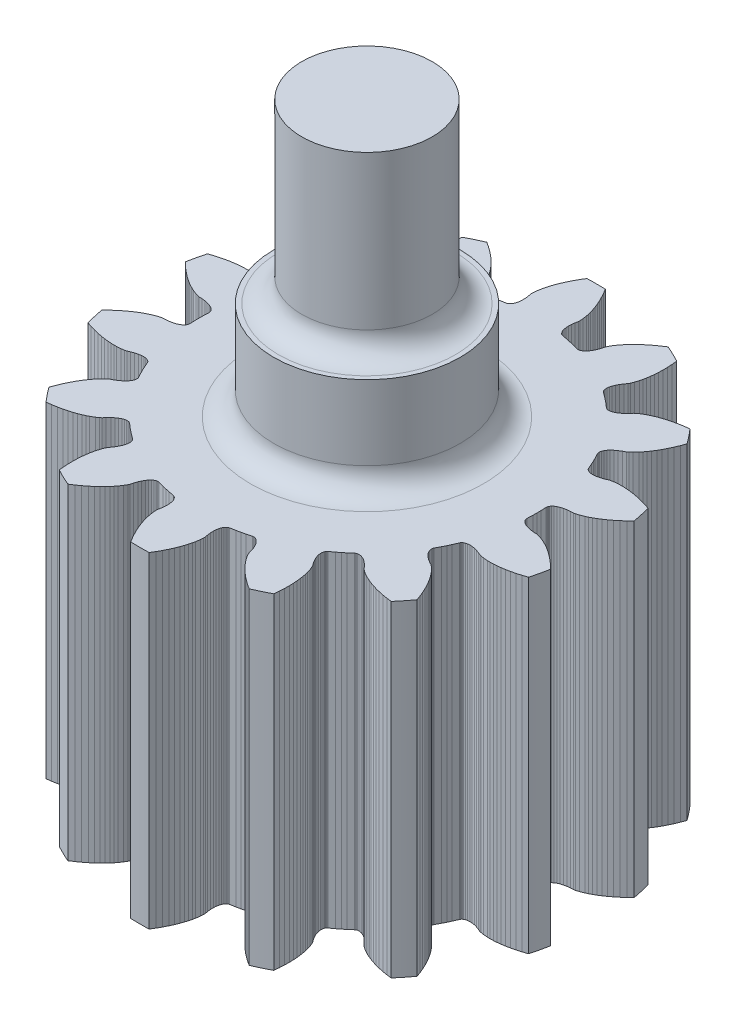
from build123d import *

# Parameters (mm, degrees)
SKETCH1_R           = 2
BOSS_EXTRUDE1_DEPTH = 2.1
SKETCH2_R           = 1.4
BOSS_EXTRUDE3_DEPTH = 3.8
BOSS_EXTRUDE4_DEPTH = 7
FILLET1_R           = 0.5


with BuildPart() as part:
    # Sketch1 → Boss-Extrude1 (new body)
    with BuildSketch(Plane(origin=(0, 0, 0), x_dir=(1, 0, 0), z_dir=(0, 1, 0))):
        Circle(SKETCH1_R)
    extrude(amount=BOSS_EXTRUDE1_DEPTH)

    # Sketch2 → Boss-Extrude3 (add)
    with BuildSketch(Plane(origin=(0, 2.1, 0), x_dir=(1, 0, 0), z_dir=(0, 1, 0))):
        Circle(SKETCH2_R)
    extrude(amount=BOSS_EXTRUDE3_DEPTH)

    # Sketch4 → Boss-Extrude4 (add)
    with BuildSketch(Plane.XZ):
        with BuildLine():
            Line((-3.882190711, -2.730032774), (-3.922357711, -2.826903874))
            Line((-3.922357711, -2.826903874), (-3.959795863, -2.92899104))
            ThreePointArc((-3.959795863, -2.92899104), (-3.839676009, -3.086014144), (-3.713318819, -3.238063133))
            Line((-3.713318819, -3.238063133), (-3.605460319, -3.224280033))
            Line((-3.605460319, -3.224280033), (-3.502080019, -3.206675933))
            Line((-3.502080019, -3.206675933), (-3.402592619, -3.185404633))
            Line((-3.402592619, -3.185404633), (-3.313761919, -3.162452233))
            Line((-3.313761919, -3.162452233), (-3.233593119, -3.138155933))
            Line((-3.233593119, -3.138155933), (-3.159130419, -3.112161433))
            Line((-3.159130419, -3.112161433), (-3.092797119, -3.085823533))
            Line((-3.092797119, -3.085823533), (-3.034401719, -3.059767933))
            Line((-3.034401719, -3.059767933), (-2.982345219, -3.033850233))
            Line((-2.982345219, -3.033850233), (-2.902885819, -2.988037433))
            Line((-2.902885819, -2.988037433), (-2.849189719, -2.950841433))
            Line((-2.849189719, -2.950841433), (-2.819950519, -2.926718933))
            Line((-2.819950519, -2.926718933), (-2.780656419, -2.880621433))
            Line((-2.780656419, -2.880621433), (-2.731486019, -2.830415233))
            Line((-2.731486019, -2.830415233), (-2.683265219, -2.789210933))
            Line((-2.683265219, -2.789210933), (-2.636656719, -2.756812533))
            Line((-2.636656719, -2.756812533), (-2.592302519, -2.733015133))
            Line((-2.592302519, -2.733015133), (-2.550843419, -2.717563333))
            Line((-2.550843419, -2.717563333), (-2.512882719, -2.710155233))
            Line((-2.512882719, -2.710155233), (-2.479026819, -2.710460633))
            Line((-2.479026819, -2.710460633), (-2.463811019, -2.713385733))
            Line((-2.463811019, -2.713385733), (-2.449837119, -2.718108733))
            Line((-2.449837119, -2.718108733), (-2.437161419, -2.724571933))
            Line((-2.437161419, -2.724571933), (-2.425862119, -2.732713033))
            Line((-2.425862119, -2.732713033), (-2.335971819, -2.810486433))
            Line((-2.335971819, -2.810486433), (-2.269113919, -2.865095733))
            Line((-2.269113919, -2.865095733), (-2.200996419, -2.918125733))
            Line((-2.200996419, -2.918125733), (-2.105170519, -2.988456133))
            Line((-2.105170519, -2.988456133), (-2.094719219, -2.997660533))
            Line((-2.094719219, -2.997660533), (-2.085597419, -3.008580133))
            Line((-2.085597419, -3.008580133), (-2.077883319, -3.021152733))
            Line((-2.077883319, -3.021152733), (-2.071645719, -3.035336233))
            Line((-2.071645719, -3.035336233), (-2.063814319, -3.068275333))
            Line((-2.063814319, -3.068275333), (-2.062589619, -3.106932733))
            Line((-2.062589619, -3.106932733), (-2.068428519, -3.150790633))
            Line((-2.068428519, -3.150790633), (-2.081759619, -3.199328233))
            Line((-2.081759619, -3.199328233), (-2.102974319, -3.251977533))
            Line((-2.102974319, -3.251977533), (-2.132415419, -3.308158133))
            Line((-2.132415419, -3.308158133), (-2.170421319, -3.367267633))
            Line((-2.170421319, -3.367267633), (-2.206619419, -3.415834233))
            Line((-2.206619419, -3.415834233), (-2.223630719, -3.449708033))
            Line((-2.223630719, -3.449708033), (-2.247945619, -3.510334833))
            Line((-2.247945619, -3.510334833), (-2.274928419, -3.597996233))
            Line((-2.274928419, -3.597996233), (-2.288612619, -3.654514833))
            Line((-2.288612619, -3.654514833), (-2.301020719, -3.717244133))
            Line((-2.301020719, -3.717244133), (-2.311937819, -3.787775033))
            Line((-2.311937819, -3.787775033), (-2.320711019, -3.866155133))
            Line((-2.320711019, -3.866155133), (-2.326558919, -3.949720333))
            Line((-2.326558919, -3.949720333), (-2.329169219, -4.041431233))
            Line((-2.329169219, -4.041431233), (-2.327769219, -4.143157633))
            Line((-2.327769219, -4.143157633), (-2.321927619, -4.247863233))
            Line((-2.321927619, -4.247863233), (-2.311364337, -4.356084574))
            ThreePointArc((-2.311364337, -4.356084574), (-2.13501511, -4.445436972), (-1.955204614, -4.527601965))
            Line((-1.955204614, -4.527601965), (-1.864007714, -4.468385765))
            Line((-1.864007714, -4.468385765), (-1.778503414, -4.407669965))
            Line((-1.778503414, -4.407669965), (-1.698097614, -4.345339265))
            Line((-1.698097614, -4.345339265), (-1.628022614, -4.286117565))
            Line((-1.628022614, -4.286117565), (-1.566334814, -4.229443465))
            Line((-1.566334814, -4.229443465), (-1.510524814, -4.173715165))
            Line((-1.510524814, -4.173715165), (-1.462188214, -4.121204465))
            Line((-1.462188214, -4.121204465), (-1.420880814, -4.072392365))
            Line((-1.420880814, -4.072392365), (-1.385224814, -4.026454865))
            Line((-1.385224814, -4.026454865), (-1.333511814, -3.950702865))
            Line((-1.333511814, -3.950702865), (-1.301272014, -3.893892465))
            Line((-1.301272014, -3.893892465), (-1.285394814, -3.859472565))
            Line((-1.285394814, -3.859472565), (-1.269993014, -3.800890965))
            Line((-1.269993014, -3.800890965), (-1.247475614, -3.734322565))
            Line((-1.247475614, -3.734322565), (-1.221908114, -3.676276565))
            Line((-1.221908114, -3.676276565), (-1.193972314, -3.626863965))
            Line((-1.193972314, -3.626863965), (-1.164335914, -3.586178665))
            Line((-1.164335914, -3.586178665), (-1.133686914, -3.554268665))
            Line((-1.133686914, -3.554268665), (-1.102699714, -3.531123665))
            Line((-1.102699714, -3.531123665), (-1.072064114, -3.516709265))
            Line((-1.072064114, -3.516709265), (-1.057086014, -3.512742765))
            Line((-1.057086014, -3.512742765), (-1.042446714, -3.510935065))
            Line((-1.042446714, -3.510935065), (-1.028222014, -3.511258465))
            Line((-1.028222014, -3.511258465), (-1.014509414, -3.513690765))
            Line((-1.014509414, -3.513690765), (-0.899776414, -3.544760165))
            Line((-0.899776414, -3.544760165), (-0.815845414, -3.564952865))
            Line((-0.815845414, -3.564952865), (-0.731464914, -3.583176265))
            Line((-0.731464914, -3.583176265), (-0.614613514, -3.604964365))
            Line((-0.614613514, -3.604964365), (-0.601203514, -3.608722565))
            Line((-0.601203514, -3.608722565), (-0.588247214, -3.614603065))
            Line((-0.588247214, -3.614603065), (-0.575842014, -3.622583565))
            Line((-0.575842014, -3.622583565), (-0.564068214, -3.632656065))
            Line((-0.564068214, -3.632656065), (-0.542720614, -3.658935165))
            Line((-0.542720614, -3.658935165), (-0.524844414, -3.693232965))
            Line((-0.524844414, -3.693232965), (-0.511075814, -3.735280965))
            Line((-0.511075814, -3.735280965), (-0.502027014, -3.784795965))
            Line((-0.502027014, -3.784795965), (-0.498297114, -3.841436065))
            Line((-0.498297114, -3.841436065), (-0.500446814, -3.904827065))
            Line((-0.500446814, -3.904827065), (-0.509042314, -3.974573065))
            Line((-0.509042314, -3.974573065), (-0.520583314, -4.034035765))
            Line((-0.520583314, -4.034035765), (-0.521212714, -4.071935965))
            Line((-0.521212714, -4.071935965), (-0.516814714, -4.137108665))
            Line((-0.516814714, -4.137108665), (-0.503090514, -4.227796265))
            Line((-0.503090514, -4.227796265), (-0.490897114, -4.284655165))
            Line((-0.490897114, -4.284655165), (-0.474859214, -4.346555865))
            Line((-0.474859214, -4.346555865), (-0.454092914, -4.414838765))
            Line((-0.454092914, -4.414838765), (-0.427989514, -4.489263365))
            Line((-0.427989514, -4.489263365), (-0.397000614, -4.567090265))
            Line((-0.397000614, -4.567090265), (-0.359560614, -4.650851565))
            Line((-0.359560614, -4.650851565), (-0.314161714, -4.741896465))
            Line((-0.314161714, -4.741896465), (-0.263468614, -4.833698365))
            Line((-0.263468614, -4.833698365), (-0.206984165, -4.926626267))
            ThreePointArc((-0.206984165, -4.926626267), (-0.009328709, -4.930614744), (0.188326735, -4.926625674))
            Line((0.188326735, -4.926625674), (0.244799335, -4.833704874))
            Line((0.244799335, -4.833704874), (0.295492535, -4.741902974))
            Line((0.295492535, -4.741902974), (0.340891335, -4.650858074))
            Line((0.340891335, -4.650858074), (0.378331435, -4.567096774))
            Line((0.378331435, -4.567096774), (0.409320235, -4.489269874))
            Line((0.409320235, -4.489269874), (0.435423735, -4.414845274))
            Line((0.435423735, -4.414845274), (0.456189935, -4.346562374))
            Line((0.456189935, -4.346562374), (0.472227835, -4.284661674))
            Line((0.472227835, -4.284661674), (0.484421335, -4.227802774))
            Line((0.484421335, -4.227802774), (0.498145535, -4.137115174))
            Line((0.498145535, -4.137115174), (0.502543435, -4.071942474))
            Line((0.502543435, -4.071942474), (0.501914135, -4.034042274))
            Line((0.501914135, -4.034042274), (0.490373035, -3.974579574))
            Line((0.490373035, -3.974579574), (0.481777635, -3.904833574))
            Line((0.481777635, -3.904833574), (0.479627835, -3.841442574))
            Line((0.479627835, -3.841442574), (0.483357835, -3.784802474))
            Line((0.483357835, -3.784802474), (0.492406535, -3.735287474))
            Line((0.492406535, -3.735287474), (0.506175235, -3.693239474))
            Line((0.506175235, -3.693239474), (0.524051435, -3.658941674))
            Line((0.524051435, -3.658941674), (0.545398935, -3.632662574))
            Line((0.545398935, -3.632662574), (0.557172835, -3.622590074))
            Line((0.557172835, -3.622590074), (0.569578035, -3.614609574))
            Line((0.569578035, -3.614609574), (0.582534335, -3.608729074))
            Line((0.582534335, -3.608729074), (0.595944235, -3.604970874))
            Line((0.595944235, -3.604970874), (0.712795635, -3.583182774))
            Line((0.712795635, -3.583182774), (0.797176235, -3.564959374))
            Line((0.797176235, -3.564959374), (0.881107235, -3.544766674))
            Line((0.881107235, -3.544766674), (0.995840235, -3.513697274))
            Line((0.995840235, -3.513697274), (1.009552735, -3.511264974))
            Line((1.009552735, -3.511264974), (1.023777435, -3.510941574))
            Line((1.023777435, -3.510941574), (1.038416735, -3.512749274))
            Line((1.038416735, -3.512749274), (1.053394935, -3.516715774))
            Line((1.053394935, -3.516715774), (1.084030535, -3.531130174))
            Line((1.084030535, -3.531130174), (1.115017635, -3.554275174))
            Line((1.115017635, -3.554275174), (1.145666735, -3.586185174))
            Line((1.145666735, -3.586185174), (1.175303135, -3.626870474))
            Line((1.175303135, -3.626870474), (1.203238835, -3.676283074))
            Line((1.203238835, -3.676283074), (1.228806335, -3.734329074))
            Line((1.228806335, -3.734329074), (1.251323835, -3.800897474))
            Line((1.251323835, -3.800897474), (1.266725535, -3.859479074))
            Line((1.266725535, -3.859479074), (1.282602835, -3.893898974))
            Line((1.282602835, -3.893898974), (1.314842635, -3.950709374))
            Line((1.314842635, -3.950709374), (1.366555535, -4.026461374))
            Line((1.366555535, -4.026461374), (1.402211635, -4.072398874))
            Line((1.402211635, -4.072398874), (1.443518935, -4.121210974))
            Line((1.443518935, -4.121210974), (1.491855635, -4.173721674))
            Line((1.491855635, -4.173721674), (1.547665635, -4.229449974))
            Line((1.547665635, -4.229449974), (1.609353435, -4.286124074))
            Line((1.609353435, -4.286124074), (1.679428435, -4.345345774))
            Line((1.679428435, -4.345345774), (1.759834235, -4.407676474))
            Line((1.759834235, -4.407676474), (1.845338535, -4.468392274))
            Line((1.845338535, -4.468392274), (1.936535456, -4.527608514))
            ThreePointArc((1.936535456, -4.527608514), (2.116347462, -4.445442796), (2.292698143, -4.356089563))
            Line((2.292698143, -4.356089563), (2.303261443, -4.247868263))
            Line((2.303261443, -4.247868263), (2.309102943, -4.143162663))
            Line((2.309102943, -4.143162663), (2.310503043, -4.041436263))
            Line((2.310503043, -4.041436263), (2.307892743, -3.949725363))
            Line((2.307892743, -3.949725363), (2.302044843, -3.866160163))
            Line((2.302044843, -3.866160163), (2.293271643, -3.787780063))
            Line((2.293271643, -3.787780063), (2.282354543, -3.717249163))
            Line((2.282354543, -3.717249163), (2.269946443, -3.654519863))
            Line((2.269946443, -3.654519863), (2.256262243, -3.598001263))
            Line((2.256262243, -3.598001263), (2.229279343, -3.510339863))
            Line((2.229279343, -3.510339863), (2.204964443, -3.449713063))
            Line((2.204964443, -3.449713063), (2.187953143, -3.415839263))
            Line((2.187953143, -3.415839263), (2.151755143, -3.367272663))
            Line((2.151755143, -3.367272663), (2.113749243, -3.308163163))
            Line((2.113749243, -3.308163163), (2.084308043, -3.251982563))
            Line((2.084308043, -3.251982563), (2.063093443, -3.199333263))
            Line((2.063093443, -3.199333263), (2.049762343, -3.150795663))
            Line((2.049762343, -3.150795663), (2.043923443, -3.106937763))
            Line((2.043923443, -3.106937763), (2.045148143, -3.068280363))
            Line((2.045148143, -3.068280363), (2.052979543, -3.035341263))
            Line((2.052979543, -3.035341263), (2.059217143, -3.021157763))
            Line((2.059217143, -3.021157763), (2.066931243, -3.008585163))
            Line((2.066931243, -3.008585163), (2.076053043, -2.997665563))
            Line((2.076053043, -2.997665563), (2.086504343, -2.988461163))
            Line((2.086504343, -2.988461163), (2.182330243, -2.918130763))
            Line((2.182330243, -2.918130763), (2.250447643, -2.865100763))
            Line((2.250447643, -2.865100763), (2.317305643, -2.810491463))
            Line((2.317305643, -2.810491463), (2.407195943, -2.732718063))
            Line((2.407195943, -2.732718063), (2.418495143, -2.724576963))
            Line((2.418495143, -2.724576963), (2.431170843, -2.718113763))
            Line((2.431170843, -2.718113763), (2.445144743, -2.713390763))
            Line((2.445144743, -2.713390763), (2.460360643, -2.710465663))
            Line((2.460360643, -2.710465663), (2.494216543, -2.710160263))
            Line((2.494216543, -2.710160263), (2.532177243, -2.717568363))
            Line((2.532177243, -2.717568363), (2.573636343, -2.733020163))
            Line((2.573636343, -2.733020163), (2.617990443, -2.756817563))
            Line((2.617990443, -2.756817563), (2.664599043, -2.789215963))
            Line((2.664599043, -2.789215963), (2.712819743, -2.830420263))
            Line((2.712819743, -2.830420263), (2.761990243, -2.880626463))
            Line((2.761990243, -2.880626463), (2.801284343, -2.926723963))
            Line((2.801284343, -2.926723963), (2.830523443, -2.950846463))
            Line((2.830523443, -2.950846463), (2.884219643, -2.988042463))
            Line((2.884219643, -2.988042463), (2.963678943, -3.033855263))
            Line((2.963678943, -3.033855263), (3.015735543, -3.059772963))
            Line((3.015735543, -3.059772963), (3.074130943, -3.085828563))
            Line((3.074130943, -3.085828563), (3.140464243, -3.112166463))
            Line((3.140464243, -3.112166463), (3.214926943, -3.138160963))
            Line((3.214926943, -3.138160963), (3.295095643, -3.162457263))
            Line((3.295095643, -3.162457263), (3.383926343, -3.185409663))
            Line((3.383926343, -3.185409663), (3.483413843, -3.206680963))
            Line((3.483413843, -3.206680963), (3.586794143, -3.224285063))
            Line((3.586794143, -3.224285063), (3.694661261, -3.238058062))
            ThreePointArc((3.694661261, -3.238058062), (3.821015753, -3.086011601), (3.941133142, -2.92899123))
            Line((3.941133142, -2.92899123), (3.903694842, -2.82690403))
            Line((3.903694842, -2.82690403), (3.863527842, -2.73003293))
            Line((3.863527842, -2.73003293), (3.820651842, -2.63777313))
            Line((3.820651842, -2.63777313), (3.778508142, -2.55627703))
            Line((3.778508142, -2.55627703), (3.736981742, -2.48352463))
            Line((3.736981742, -2.48352463), (3.695069542, -2.41671323))
            Line((3.695069542, -2.41671323), (3.654631342, -2.35790383))
            Line((3.654631342, -2.35790383), (3.616234942, -2.30677043))
            Line((3.616234942, -2.30677043), (3.579383342, -2.26178623))
            Line((3.579383342, -2.26178623), (3.517037742, -2.19451343))
            Line((3.517037742, -2.19451343), (3.468825842, -2.15044043))
            Line((3.468825842, -2.15044043), (3.438801842, -2.12730213))
            Line((3.438801842, -2.12730213), (3.385116242, -2.09925093))
            Line((3.385116242, -2.09925093), (3.325227442, -2.06248513))
            Line((3.325227442, -2.06248513), (3.274326042, -2.02464223))
            Line((3.274326042, -2.02464223), (3.232368642, -1.98641153))
            Line((3.232368642, -1.98641153), (3.199298142, -1.94846493))
            Line((3.199298142, -1.94846493), (3.175008242, -1.91148363))
            Line((3.175008242, -1.91148363), (3.159338842, -1.87612313))
            Line((3.159338842, -1.87612313), (3.152102942, -1.84304813))
            Line((3.152102942, -1.84304813), (3.151568842, -1.82756283))
            Line((3.151568842, -1.82756283), (3.153063942, -1.81288833))
            Line((3.153063942, -1.81288833), (3.156544542, -1.79909223))
            Line((3.156544542, -1.79909223), (3.161967142, -1.78626473))
            Line((3.161967142, -1.78626473), (3.217788142, -1.68132193))
            Line((3.217788142, -1.68132193), (3.256150942, -1.60398853))
            Line((3.256150942, -1.60398853), (3.292693842, -1.52577873))
            Line((3.292693842, -1.52577873), (3.339937642, -1.41670533))
            Line((3.339937642, -1.41670533), (3.346585642, -1.40446793))
            Line((3.346585642, -1.40446793), (3.355201742, -1.39314493))
            Line((3.355201742, -1.39314493), (3.365742542, -1.38282663))
            Line((3.365742542, -1.38282663), (3.378182342, -1.37358933))
            Line((3.378182342, -1.37358933), (3.408552942, -1.35862463))
            Line((3.408552942, -1.35862463), (3.445968642, -1.34882853))
            Line((3.445968642, -1.34882853), (3.490026242, -1.34476173))
            Line((3.490026242, -1.34476173), (3.540313342, -1.34695793))
            Line((3.540313342, -1.34695793), (3.596363242, -1.35592513))
            Line((3.596363242, -1.35592513), (3.657686542, -1.37212673))
            Line((3.657686542, -1.37212673), (3.723771242, -1.39602663))
            Line((3.723771242, -1.39602663), (3.779174942, -1.42051003))
            Line((3.779174942, -1.42051003), (3.815984842, -1.42955723))
            Line((3.815984842, -1.42955723), (3.880502142, -1.43977183))
            Line((3.880502142, -1.43977183), (3.971970042, -1.44657163))
            Line((3.971970042, -1.44657163), (4.030116642, -1.44733623))
            Line((4.030116642, -1.44733623), (4.094034142, -1.44547463))
            Line((4.094034142, -1.44547463), (4.165225942, -1.44042333))
            Line((4.165225942, -1.44042333), (4.243593142, -1.43153543))
            Line((4.243593142, -1.43153543), (4.326364442, -1.41864163))
            Line((4.326364442, -1.41864163), (4.416356842, -1.40077893))
            Line((4.416356842, -1.40077893), (4.515221242, -1.37677773))
            Line((4.515221242, -1.37677773), (4.616001842, -1.34778343))
            Line((4.616001842, -1.34778343), (4.719159118, -1.313403525))
            ThreePointArc((4.719159118, -1.313403525), (4.767030365, -1.121591323), (4.807124083, -0.92800395))
            Line((4.807124083, -0.92800395), (4.729099383, -0.85227045))
            Line((4.729099383, -0.85227045), (4.650879383, -0.78242045))
            Line((4.650879383, -0.78242045), (4.572219383, -0.71790045))
            Line((4.572219383, -0.71790045), (4.498889383, -0.66276045))
            Line((4.498889383, -0.66276045), (4.429909383, -0.61523045))
            Line((4.429909383, -0.61523045), (4.363159383, -0.57322045))
            Line((4.363159383, -0.57322045), (4.301209383, -0.53778045))
            Line((4.301209383, -0.53778045), (4.244429383, -0.50837045))
            Line((4.244429383, -0.50837045), (4.191709383, -0.48383045))
            Line((4.191709383, -0.48383045), (4.106349383, -0.45027045))
            Line((4.106349383, -0.45027045), (4.043789383, -0.43148045))
            Line((4.043789383, -0.43148045), (4.006699383, -0.42366045))
            Line((4.006699383, -0.42366045), (3.946159383, -0.42168045))
            Line((3.946159383, -0.42168045), (3.876249383, -0.41454045))
            Line((3.876249383, -0.41454045), (3.813969383, -0.40253045))
            Line((3.813969383, -0.40253045), (3.759579383, -0.38629045))
            Line((3.759579383, -0.38629045), (3.713319383, -0.36645045))
            Line((3.713319383, -0.36645045), (3.675389383, -0.34367045))
            Line((3.675389383, -0.34367045), (3.645929383, -0.31861045))
            Line((3.645929383, -0.31861045), (3.625059383, -0.29195045))
            Line((3.625059383, -0.29195045), (3.617859383, -0.27823045))
            Line((3.617859383, -0.27823045), (3.612839383, -0.26436045))
            Line((3.612839383, -0.26436045), (3.609989383, -0.25042045))
            Line((3.609989383, -0.25042045), (3.609309383, -0.23651045))
            Line((3.609309383, -0.23651045), (3.614069383, -0.11774045))
            Line((3.614069383, -0.11774045), (3.615079383, -0.03142045))
            Line((3.615079383, -0.03142045), (3.614069383, 0.05489955))
            Line((3.614069383, 0.05489955), (3.609309383, 0.17366955))
            Line((3.609309383, 0.17366955), (3.609989383, 0.18757955))
            Line((3.609989383, 0.18757955), (3.612839383, 0.20151955))
            Line((3.612839383, 0.20151955), (3.617859383, 0.21538955))
            Line((3.617859383, 0.21538955), (3.625059383, 0.22910955))
            Line((3.625059383, 0.22910955), (3.645929383, 0.25576955))
            Line((3.645929383, 0.25576955), (3.675389383, 0.28082955))
            Line((3.675389383, 0.28082955), (3.713319383, 0.30360955))
            Line((3.713319383, 0.30360955), (3.759579383, 0.32344955))
            Line((3.759579383, 0.32344955), (3.813969383, 0.33968955))
            Line((3.813969383, 0.33968955), (3.876249383, 0.35169955))
            Line((3.876249383, 0.35169955), (3.946159383, 0.35883955))
            Line((3.946159383, 0.35883955), (4.006699383, 0.36081955))
            Line((4.006699383, 0.36081955), (4.043789383, 0.36863955))
            Line((4.043789383, 0.36863955), (4.106349383, 0.38742955))
            Line((4.106349383, 0.38742955), (4.191709383, 0.42098955))
            Line((4.191709383, 0.42098955), (4.244429383, 0.44552955))
            Line((4.244429383, 0.44552955), (4.301209383, 0.47493955))
            Line((4.301209383, 0.47493955), (4.363159383, 0.51037955))
            Line((4.363159383, 0.51037955), (4.429909383, 0.55238955))
            Line((4.429909383, 0.55238955), (4.498889383, 0.59991955))
            Line((4.498889383, 0.59991955), (4.572219383, 0.65505955))
            Line((4.572219383, 0.65505955), (4.650879383, 0.71957955))
            Line((4.650879383, 0.71957955), (4.729099383, 0.78942955))
            Line((4.729099383, 0.78942955), (4.807121423, 0.86517709))
            ThreePointArc((4.807121423, 0.86517709), (4.767027431, 1.058764474), (4.719155905, 1.250576674))
            Line((4.719155905, 1.250576674), (4.615998701, 1.28495652))
            Line((4.615998701, 1.28495652), (4.515218101, 1.31395082))
            Line((4.515218101, 1.31395082), (4.416353701, 1.33795202))
            Line((4.416353701, 1.33795202), (4.326361301, 1.35581472))
            Line((4.326361301, 1.35581472), (4.243590001, 1.36870852))
            Line((4.243590001, 1.36870852), (4.165222801, 1.37759642))
            Line((4.165222801, 1.37759642), (4.094031001, 1.38264772))
            Line((4.094031001, 1.38264772), (4.030113501, 1.38450932))
            Line((4.030113501, 1.38450932), (3.971966901, 1.38374472))
            Line((3.971966901, 1.38374472), (3.880499001, 1.37694492))
            Line((3.880499001, 1.37694492), (3.815981701, 1.36673032))
            Line((3.815981701, 1.36673032), (3.779171801, 1.35768312))
            Line((3.779171801, 1.35768312), (3.723768101, 1.33319972))
            Line((3.723768101, 1.33319972), (3.657683401, 1.30929982))
            Line((3.657683401, 1.30929982), (3.596360101, 1.29309822))
            Line((3.596360101, 1.29309822), (3.540310201, 1.28413102))
            Line((3.540310201, 1.28413102), (3.490023101, 1.28193482))
            Line((3.490023101, 1.28193482), (3.445965501, 1.28600162))
            Line((3.445965501, 1.28600162), (3.408549801, 1.29579772))
            Line((3.408549801, 1.29579772), (3.378179201, 1.31076242))
            Line((3.378179201, 1.31076242), (3.365739401, 1.31999972))
            Line((3.365739401, 1.31999972), (3.355198601, 1.33031802))
            Line((3.355198601, 1.33031802), (3.346582501, 1.34164102))
            Line((3.346582501, 1.34164102), (3.339934501, 1.35387842))
            Line((3.339934501, 1.35387842), (3.292690701, 1.46295182))
            Line((3.292690701, 1.46295182), (3.256147801, 1.54116162))
            Line((3.256147801, 1.54116162), (3.217785001, 1.61849502))
            Line((3.217785001, 1.61849502), (3.161964001, 1.72343782))
            Line((3.161964001, 1.72343782), (3.156541401, 1.73626532))
            Line((3.156541401, 1.73626532), (3.153060801, 1.75006142))
            Line((3.153060801, 1.75006142), (3.151565701, 1.76473592))
            Line((3.151565701, 1.76473592), (3.152099801, 1.78022122))
            Line((3.152099801, 1.78022122), (3.159335701, 1.81329622))
            Line((3.159335701, 1.81329622), (3.175005101, 1.84865672))
            Line((3.175005101, 1.84865672), (3.199295001, 1.88563802))
            Line((3.199295001, 1.88563802), (3.232365501, 1.92358462))
            Line((3.232365501, 1.92358462), (3.274322901, 1.96181532))
            Line((3.274322901, 1.96181532), (3.325224301, 1.99965822))
            Line((3.325224301, 1.99965822), (3.385113101, 2.03642402))
            Line((3.385113101, 2.03642402), (3.438798701, 2.06447522))
            Line((3.438798701, 2.06447522), (3.468822701, 2.08761352))
            Line((3.468822701, 2.08761352), (3.517034601, 2.13168652))
            Line((3.517034601, 2.13168652), (3.579380201, 2.19895932))
            Line((3.579380201, 2.19895932), (3.616231801, 2.24394352))
            Line((3.616231801, 2.24394352), (3.654628201, 2.29507692))
            Line((3.654628201, 2.29507692), (3.695066401, 2.35388632))
            Line((3.695066401, 2.35388632), (3.736978601, 2.42069772))
            Line((3.736978601, 2.42069772), (3.778505001, 2.49345012))
            Line((3.778505001, 2.49345012), (3.820648701, 2.57494622))
            Line((3.820648701, 2.57494622), (3.863524701, 2.66720602))
            Line((3.863524701, 2.66720602), (3.903691701, 2.76407712))
            Line((3.903691701, 2.76407712), (3.941129952, 2.866164286))
            ThreePointArc((3.941129952, 2.866164286), (3.82101239, 3.023184444), (3.694657736, 3.175230687))
            Line((3.694657736, 3.175230687), (3.586799236, 3.161447587))
            Line((3.586799236, 3.161447587), (3.483418936, 3.143843487))
            Line((3.483418936, 3.143843487), (3.383931436, 3.122572187))
            Line((3.383931436, 3.122572187), (3.295100736, 3.099619787))
            Line((3.295100736, 3.099619787), (3.214932036, 3.075323487))
            Line((3.214932036, 3.075323487), (3.140469336, 3.049328987))
            Line((3.140469336, 3.049328987), (3.074136036, 3.022991087))
            Line((3.074136036, 3.022991087), (3.015740636, 2.996935487))
            Line((3.015740636, 2.996935487), (2.963684036, 2.971017787))
            Line((2.963684036, 2.971017787), (2.884224736, 2.925204987))
            Line((2.884224736, 2.925204987), (2.830528536, 2.888008987))
            Line((2.830528536, 2.888008987), (2.801289436, 2.863886487))
            Line((2.801289436, 2.863886487), (2.761995336, 2.817788987))
            Line((2.761995336, 2.817788987), (2.712824836, 2.767582787))
            Line((2.712824836, 2.767582787), (2.664604136, 2.726378487))
            Line((2.664604136, 2.726378487), (2.617995536, 2.693980087))
            Line((2.617995536, 2.693980087), (2.573641436, 2.670182687))
            Line((2.573641436, 2.670182687), (2.532182336, 2.654730887))
            Line((2.532182336, 2.654730887), (2.494221636, 2.647322787))
            Line((2.494221636, 2.647322787), (2.460365736, 2.647628187))
            Line((2.460365736, 2.647628187), (2.445149836, 2.650553287))
            Line((2.445149836, 2.650553287), (2.431175936, 2.655276287))
            Line((2.431175936, 2.655276287), (2.418500236, 2.661739487))
            Line((2.418500236, 2.661739487), (2.407201036, 2.669880587))
            Line((2.407201036, 2.669880587), (2.317310736, 2.747653987))
            Line((2.317310736, 2.747653987), (2.250452736, 2.802263287))
            Line((2.250452736, 2.802263287), (2.182335336, 2.855293287))
            Line((2.182335336, 2.855293287), (2.086509436, 2.925623687))
            Line((2.086509436, 2.925623687), (2.076058136, 2.934828087))
            Line((2.076058136, 2.934828087), (2.066936336, 2.945747687))
            Line((2.066936336, 2.945747687), (2.059222236, 2.958320287))
            Line((2.059222236, 2.958320287), (2.052984636, 2.972503787))
            Line((2.052984636, 2.972503787), (2.045153236, 3.005442887))
            Line((2.045153236, 3.005442887), (2.043928536, 3.044100287))
            Line((2.043928536, 3.044100287), (2.049767436, 3.087958187))
            Line((2.049767436, 3.087958187), (2.063098536, 3.136495787))
            Line((2.063098536, 3.136495787), (2.084313136, 3.189145087))
            Line((2.084313136, 3.189145087), (2.113754336, 3.245325687))
            Line((2.113754336, 3.245325687), (2.151760236, 3.304435187))
            Line((2.151760236, 3.304435187), (2.187958236, 3.353001787))
            Line((2.187958236, 3.353001787), (2.204969536, 3.386875587))
            Line((2.204969536, 3.386875587), (2.229284436, 3.447502387))
            Line((2.229284436, 3.447502387), (2.256267336, 3.535163787))
            Line((2.256267336, 3.535163787), (2.269951536, 3.591682387))
            Line((2.269951536, 3.591682387), (2.282359636, 3.654411687))
            Line((2.282359636, 3.654411687), (2.293276736, 3.724942587))
            Line((2.293276736, 3.724942587), (2.302049936, 3.803322687))
            Line((2.302049936, 3.803322687), (2.307897836, 3.886887887))
            Line((2.307897836, 3.886887887), (2.310508136, 3.978598787))
            Line((2.310508136, 3.978598787), (2.309108036, 4.080325187))
            Line((2.309108036, 4.080325187), (2.303266536, 4.185030787))
            Line((2.303266536, 4.185030787), (2.292703254, 4.293252128))
            ThreePointArc((2.292703254, 4.293252128), (2.116352641, 4.382605631), (1.936540691, 4.464771617))
            Line((1.936540691, 4.464771617), (1.845330967, 4.405560926))
            Line((1.845330967, 4.405560926), (1.759826667, 4.344845126))
            Line((1.759826667, 4.344845126), (1.679420867, 4.282514426))
            Line((1.679420867, 4.282514426), (1.609345867, 4.223292726))
            Line((1.609345867, 4.223292726), (1.547658067, 4.166618626))
            Line((1.547658067, 4.166618626), (1.491848067, 4.110890326))
            Line((1.491848067, 4.110890326), (1.443511367, 4.058379626))
            Line((1.443511367, 4.058379626), (1.402204067, 4.009567526))
            Line((1.402204067, 4.009567526), (1.366547967, 3.963630026))
            Line((1.366547967, 3.963630026), (1.314835067, 3.887878026))
            Line((1.314835067, 3.887878026), (1.282595267, 3.831067626))
            Line((1.282595267, 3.831067626), (1.266717967, 3.796647726))
            Line((1.266717967, 3.796647726), (1.251316267, 3.738066126))
            Line((1.251316267, 3.738066126), (1.228798767, 3.671497726))
            Line((1.228798767, 3.671497726), (1.203231267, 3.613451726))
            Line((1.203231267, 3.613451726), (1.175295567, 3.564039126))
            Line((1.175295567, 3.564039126), (1.145659167, 3.523353826))
            Line((1.145659167, 3.523353826), (1.115010067, 3.491443826))
            Line((1.115010067, 3.491443826), (1.084022967, 3.468298826))
            Line((1.084022967, 3.468298826), (1.053387367, 3.453884426))
            Line((1.053387367, 3.453884426), (1.038409167, 3.449917926))
            Line((1.038409167, 3.449917926), (1.023769867, 3.448110226))
            Line((1.023769867, 3.448110226), (1.009545167, 3.448433626))
            Line((1.009545167, 3.448433626), (0.995832667, 3.450865926))
            Line((0.995832667, 3.450865926), (0.881099667, 3.481935326))
            Line((0.881099667, 3.481935326), (0.797168667, 3.502128026))
            Line((0.797168667, 3.502128026), (0.712788067, 3.520351426))
            Line((0.712788067, 3.520351426), (0.595936667, 3.542139526))
            Line((0.595936667, 3.542139526), (0.582526767, 3.545897726))
            Line((0.582526767, 3.545897726), (0.569570467, 3.551778226))
            Line((0.569570467, 3.551778226), (0.557165267, 3.559758726))
            Line((0.557165267, 3.559758726), (0.545391367, 3.569831226))
            Line((0.545391367, 3.569831226), (0.524043867, 3.596110326))
            Line((0.524043867, 3.596110326), (0.506167667, 3.630408126))
            Line((0.506167667, 3.630408126), (0.492398967, 3.672456126))
            Line((0.492398967, 3.672456126), (0.483350267, 3.721971126))
            Line((0.483350267, 3.721971126), (0.479620267, 3.778611226))
            Line((0.479620267, 3.778611226), (0.481770067, 3.842002226))
            Line((0.481770067, 3.842002226), (0.490365467, 3.911748226))
            Line((0.490365467, 3.911748226), (0.501906567, 3.971210926))
            Line((0.501906567, 3.971210926), (0.502535867, 4.009111126))
            Line((0.502535867, 4.009111126), (0.498137967, 4.074283826))
            Line((0.498137967, 4.074283826), (0.484413767, 4.164971426))
            Line((0.484413767, 4.164971426), (0.472220267, 4.221830326))
            Line((0.472220267, 4.221830326), (0.456182367, 4.283731026))
            Line((0.456182367, 4.283731026), (0.435416167, 4.352013926))
            Line((0.435416167, 4.352013926), (0.409312667, 4.426438526))
            Line((0.409312667, 4.426438526), (0.378323867, 4.504265426))
            Line((0.378323867, 4.504265426), (0.340883767, 4.588026726))
            Line((0.340883767, 4.588026726), (0.295484967, 4.679071626))
            Line((0.295484967, 4.679071626), (0.244791767, 4.770873526))
            Line((0.244791767, 4.770873526), (0.188319166, 4.863794352))
            ThreePointArc((0.188319166, 4.863794352), (-0.009336212, 4.867783126), (-0.20699159, 4.86379436))
            Line((-0.20699159, 4.86379436), (-0.26346419, 4.77087356))
            Line((-0.26346419, 4.77087356), (-0.31415729, 4.67907166))
            Line((-0.31415729, 4.67907166), (-0.35955619, 4.58802676))
            Line((-0.35955619, 4.58802676), (-0.39699619, 4.50426546))
            Line((-0.39699619, 4.50426546), (-0.42798509, 4.42643856))
            Line((-0.42798509, 4.42643856), (-0.45408849, 4.35201396))
            Line((-0.45408849, 4.35201396), (-0.47485479, 4.28373106))
            Line((-0.47485479, 4.28373106), (-0.49089269, 4.22183036))
            Line((-0.49089269, 4.22183036), (-0.50308609, 4.16497146))
            Line((-0.50308609, 4.16497146), (-0.51681029, 4.07428386))
            Line((-0.51681029, 4.07428386), (-0.52120829, 4.00911116))
            Line((-0.52120829, 4.00911116), (-0.52057889, 3.97121096))
            Line((-0.52057889, 3.97121096), (-0.50903789, 3.91174826))
            Line((-0.50903789, 3.91174826), (-0.50044239, 3.84200226))
            Line((-0.50044239, 3.84200226), (-0.49829269, 3.77861126))
            Line((-0.49829269, 3.77861126), (-0.50202259, 3.72197116))
            Line((-0.50202259, 3.72197116), (-0.51107139, 3.67245616))
            Line((-0.51107139, 3.67245616), (-0.52483999, 3.63040816))
            Line((-0.52483999, 3.63040816), (-0.54271619, 3.59611036))
            Line((-0.54271619, 3.59611036), (-0.56406379, 3.56983126))
            Line((-0.56406379, 3.56983126), (-0.57583759, 3.55975876))
            Line((-0.57583759, 3.55975876), (-0.58824279, 3.55177826))
            Line((-0.58824279, 3.55177826), (-0.60119909, 3.54589776))
            Line((-0.60119909, 3.54589776), (-0.61460909, 3.54213956))
            Line((-0.61460909, 3.54213956), (-0.73146049, 3.52035146))
            Line((-0.73146049, 3.52035146), (-0.81584099, 3.50212806))
            Line((-0.81584099, 3.50212806), (-0.89977199, 3.48193536))
            Line((-0.89977199, 3.48193536), (-1.01450499, 3.45086596))
            Line((-1.01450499, 3.45086596), (-1.02821759, 3.44843366))
            Line((-1.02821759, 3.44843366), (-1.04244229, 3.44811026))
            Line((-1.04244229, 3.44811026), (-1.05708159, 3.44991796))
            Line((-1.05708159, 3.44991796), (-1.07205969, 3.45388446))
            Line((-1.07205969, 3.45388446), (-1.10269529, 3.46829886))
            Line((-1.10269529, 3.46829886), (-1.13368249, 3.49144386))
            Line((-1.13368249, 3.49144386), (-1.16433149, 3.52335386))
            Line((-1.16433149, 3.52335386), (-1.19396789, 3.56403916))
            Line((-1.19396789, 3.56403916), (-1.22190369, 3.61345176))
            Line((-1.22190369, 3.61345176), (-1.24747119, 3.67149776))
            Line((-1.24747119, 3.67149776), (-1.26998859, 3.73806616))
            Line((-1.26998859, 3.73806616), (-1.28539039, 3.79664776))
            Line((-1.28539039, 3.79664776), (-1.30126759, 3.83106766))
            Line((-1.30126759, 3.83106766), (-1.33350739, 3.88787806))
            Line((-1.33350739, 3.88787806), (-1.38522039, 3.96363006))
            Line((-1.38522039, 3.96363006), (-1.42087639, 4.00956756))
            Line((-1.42087639, 4.00956756), (-1.46218379, 4.05837966))
            Line((-1.46218379, 4.05837966), (-1.51052039, 4.11089036))
            Line((-1.51052039, 4.11089036), (-1.56633039, 4.16661866))
            Line((-1.56633039, 4.16661866), (-1.62801819, 4.22329276))
            Line((-1.62801819, 4.22329276), (-1.69809319, 4.28251446))
            Line((-1.69809319, 4.28251446), (-1.77849899, 4.34484516))
            Line((-1.77849899, 4.34484516), (-1.86400329, 4.40556096))
            Line((-1.86400329, 4.40556096), (-1.955200212, 4.464777201))
            ThreePointArc((-1.955200212, 4.464777201), (-2.135012401, 4.382611738), (-2.311363273, 4.293258748))
            Line((-2.311363273, 4.293258748), (-2.321926573, 4.185037448))
            Line((-2.321926573, 4.185037448), (-2.327768173, 4.080331848))
            Line((-2.327768173, 4.080331848), (-2.329168173, 3.978605448))
            Line((-2.329168173, 3.978605448), (-2.326557873, 3.886894548))
            Line((-2.326557873, 3.886894548), (-2.320709973, 3.803329348))
            Line((-2.320709973, 3.803329348), (-2.311936773, 3.724949248))
            Line((-2.311936773, 3.724949248), (-2.301019673, 3.654418348))
            Line((-2.301019673, 3.654418348), (-2.288611573, 3.591689048))
            Line((-2.288611573, 3.591689048), (-2.274927373, 3.535170448))
            Line((-2.274927373, 3.535170448), (-2.247944573, 3.447509048))
            Line((-2.247944573, 3.447509048), (-2.223629673, 3.386882248))
            Line((-2.223629673, 3.386882248), (-2.206618373, 3.353008448))
            Line((-2.206618373, 3.353008448), (-2.170420273, 3.304441848))
            Line((-2.170420273, 3.304441848), (-2.132414373, 3.245332348))
            Line((-2.132414373, 3.245332348), (-2.102973273, 3.189151748))
            Line((-2.102973273, 3.189151748), (-2.081758573, 3.136502448))
            Line((-2.081758573, 3.136502448), (-2.068427473, 3.087964848))
            Line((-2.068427473, 3.087964848), (-2.062588573, 3.044106948))
            Line((-2.062588573, 3.044106948), (-2.063813273, 3.005449548))
            Line((-2.063813273, 3.005449548), (-2.071644673, 2.972510448))
            Line((-2.071644673, 2.972510448), (-2.077882273, 2.958326948))
            Line((-2.077882273, 2.958326948), (-2.085596373, 2.945754348))
            Line((-2.085596373, 2.945754348), (-2.094718173, 2.934834748))
            Line((-2.094718173, 2.934834748), (-2.105169473, 2.925630348))
            Line((-2.105169473, 2.925630348), (-2.200995373, 2.855299948))
            Line((-2.200995373, 2.855299948), (-2.269112873, 2.802269948))
            Line((-2.269112873, 2.802269948), (-2.335970773, 2.747660648))
            Line((-2.335970773, 2.747660648), (-2.425861073, 2.669887248))
            Line((-2.425861073, 2.669887248), (-2.437160373, 2.661746148))
            Line((-2.437160373, 2.661746148), (-2.449836073, 2.655282948))
            Line((-2.449836073, 2.655282948), (-2.463809973, 2.650559948))
            Line((-2.463809973, 2.650559948), (-2.479025773, 2.647634848))
            Line((-2.479025773, 2.647634848), (-2.512881673, 2.647329448))
            Line((-2.512881673, 2.647329448), (-2.550842373, 2.654737548))
            Line((-2.550842373, 2.654737548), (-2.592301473, 2.670189348))
            Line((-2.592301473, 2.670189348), (-2.636655673, 2.693986748))
            Line((-2.636655673, 2.693986748), (-2.683264173, 2.726385148))
            Line((-2.683264173, 2.726385148), (-2.731484973, 2.767589448))
            Line((-2.731484973, 2.767589448), (-2.780655373, 2.817795648))
            Line((-2.780655373, 2.817795648), (-2.819949473, 2.863893148))
            Line((-2.819949473, 2.863893148), (-2.849188673, 2.888015648))
            Line((-2.849188673, 2.888015648), (-2.902884773, 2.925211648))
            Line((-2.902884773, 2.925211648), (-2.982344173, 2.971024448))
            Line((-2.982344173, 2.971024448), (-3.034400673, 2.996942148))
            Line((-3.034400673, 2.996942148), (-3.092796073, 3.022997748))
            Line((-3.092796073, 3.022997748), (-3.159129373, 3.049335648))
            Line((-3.159129373, 3.049335648), (-3.233592073, 3.075330148))
            Line((-3.233592073, 3.075330148), (-3.313760873, 3.099626448))
            Line((-3.313760873, 3.099626448), (-3.402591573, 3.122578848))
            Line((-3.402591573, 3.122578848), (-3.502078973, 3.143850148))
            Line((-3.502078973, 3.143850148), (-3.605459273, 3.161454248))
            Line((-3.605459273, 3.161454248), (-3.713317728, 3.175237309))
            ThreePointArc((-3.713317728, 3.175237309), (-3.839676815, 3.023186362), (-3.959798404, 2.866161162))
            Line((-3.959798404, 2.866161162), (-3.922360204, 2.764073962))
            Line((-3.922360204, 2.764073962), (-3.882193204, 2.667202862))
            Line((-3.882193204, 2.667202862), (-3.839317104, 2.574943062))
            Line((-3.839317104, 2.574943062), (-3.797173404, 2.493446962))
            Line((-3.797173404, 2.493446962), (-3.755647104, 2.420694562))
            Line((-3.755647104, 2.420694562), (-3.713734904, 2.353883162))
            Line((-3.713734904, 2.353883162), (-3.673296704, 2.295073762))
            Line((-3.673296704, 2.295073762), (-3.634900204, 2.243940362))
            Line((-3.634900204, 2.243940362), (-3.598048604, 2.198956162))
            Line((-3.598048604, 2.198956162), (-3.535703104, 2.131683362))
            Line((-3.535703104, 2.131683362), (-3.487491104, 2.087610362))
            Line((-3.487491104, 2.087610362), (-3.457467204, 2.064472062))
            Line((-3.457467204, 2.064472062), (-3.403781604, 2.036420862))
            Line((-3.403781604, 2.036420862), (-3.343892804, 1.999655062))
            Line((-3.343892804, 1.999655062), (-3.292991404, 1.961812162))
            Line((-3.292991404, 1.961812162), (-3.251034004, 1.923581462))
            Line((-3.251034004, 1.923581462), (-3.217963404, 1.885634862))
            Line((-3.217963404, 1.885634862), (-3.193673504, 1.848653562))
            Line((-3.193673504, 1.848653562), (-3.178004104, 1.813293062))
            Line((-3.178004104, 1.813293062), (-3.170768204, 1.780218062))
            Line((-3.170768204, 1.780218062), (-3.170234104, 1.764732762))
            Line((-3.170234104, 1.764732762), (-3.171729204, 1.750058262))
            Line((-3.171729204, 1.750058262), (-3.175209804, 1.736262162))
            Line((-3.175209804, 1.736262162), (-3.180632504, 1.723434662))
            Line((-3.180632504, 1.723434662), (-3.236453504, 1.618491862))
            Line((-3.236453504, 1.618491862), (-3.274816304, 1.541158462))
            Line((-3.274816304, 1.541158462), (-3.311359204, 1.462948662))
            Line((-3.311359204, 1.462948662), (-3.358602904, 1.353875262))
            Line((-3.358602904, 1.353875262), (-3.365250904, 1.341637862))
            Line((-3.365250904, 1.341637862), (-3.373867004, 1.330314862))
            Line((-3.373867004, 1.330314862), (-3.384407804, 1.319996562))
            Line((-3.384407804, 1.319996562), (-3.396847704, 1.310759262))
            Line((-3.396847704, 1.310759262), (-3.427218204, 1.295794562))
            Line((-3.427218204, 1.295794562), (-3.464633904, 1.285998462))
            Line((-3.464633904, 1.285998462), (-3.508691504, 1.281931662))
            Line((-3.508691504, 1.281931662), (-3.558978604, 1.284127862))
            Line((-3.558978604, 1.284127862), (-3.615028604, 1.293095062))
            Line((-3.615028604, 1.293095062), (-3.676351904, 1.309296662))
            Line((-3.676351904, 1.309296662), (-3.742436504, 1.333196562))
            Line((-3.742436504, 1.333196562), (-3.797840304, 1.357679962))
            Line((-3.797840304, 1.357679962), (-3.834650204, 1.366727162))
            Line((-3.834650204, 1.366727162), (-3.899167504, 1.376941762))
            Line((-3.899167504, 1.376941762), (-3.990635304, 1.383741562))
            Line((-3.990635304, 1.383741562), (-4.048781904, 1.384506162))
            Line((-4.048781904, 1.384506162), (-4.112699404, 1.382644562))
            Line((-4.112699404, 1.382644562), (-4.183891304, 1.377593262))
            Line((-4.183891304, 1.377593262), (-4.262258404, 1.368705362))
            Line((-4.262258404, 1.368705362), (-4.345029704, 1.355811562))
            Line((-4.345029704, 1.355811562), (-4.435022104, 1.337948862))
            Line((-4.435022104, 1.337948862), (-4.533886504, 1.313947662))
            Line((-4.533886504, 1.313947662), (-4.634667104, 1.284953362))
            Line((-4.634667104, 1.284953362), (-4.73782438, 1.250573458))
            ThreePointArc((-4.73782438, 1.250573458), (-4.785695562, 1.058762377), (-4.825789302, 0.865176136))
            Line((-4.825789302, 0.865176136), (-4.747764602, 0.789442636))
            Line((-4.747764602, 0.789442636), (-4.669544602, 0.719592636))
            Line((-4.669544602, 0.719592636), (-4.590884602, 0.655072636))
            Line((-4.590884602, 0.655072636), (-4.517554602, 0.599932636))
            Line((-4.517554602, 0.599932636), (-4.448574602, 0.552402636))
            Line((-4.448574602, 0.552402636), (-4.381824602, 0.510392636))
            Line((-4.381824602, 0.510392636), (-4.319874602, 0.474952636))
            Line((-4.319874602, 0.474952636), (-4.263094602, 0.445542636))
            Line((-4.263094602, 0.445542636), (-4.210374602, 0.421002636))
            Line((-4.210374602, 0.421002636), (-4.125014602, 0.387442636))
            Line((-4.125014602, 0.387442636), (-4.062454602, 0.368652636))
            Line((-4.062454602, 0.368652636), (-4.025364602, 0.360832636))
            Line((-4.025364602, 0.360832636), (-3.964824602, 0.358852636))
            Line((-3.964824602, 0.358852636), (-3.894914602, 0.351712636))
            Line((-3.894914602, 0.351712636), (-3.832634602, 0.339702636))
            Line((-3.832634602, 0.339702636), (-3.778244602, 0.323462636))
            Line((-3.778244602, 0.323462636), (-3.731984602, 0.303622636))
            Line((-3.731984602, 0.303622636), (-3.694054602, 0.280842636))
            Line((-3.694054602, 0.280842636), (-3.664594602, 0.255782636))
            Line((-3.664594602, 0.255782636), (-3.643724602, 0.229122636))
            Line((-3.643724602, 0.229122636), (-3.636524602, 0.215402636))
            Line((-3.636524602, 0.215402636), (-3.631504602, 0.201532636))
            Line((-3.631504602, 0.201532636), (-3.628654602, 0.187592636))
            Line((-3.628654602, 0.187592636), (-3.627974602, 0.173682636))
            Line((-3.627974602, 0.173682636), (-3.632734602, 0.054912636))
            Line((-3.632734602, 0.054912636), (-3.633744602, -0.031407364))
            Line((-3.633744602, -0.031407364), (-3.632734602, -0.117727364))
            Line((-3.632734602, -0.117727364), (-3.627974602, -0.236497364))
            Line((-3.627974602, -0.236497364), (-3.628654602, -0.250407364))
            Line((-3.628654602, -0.250407364), (-3.631504602, -0.264347364))
            Line((-3.631504602, -0.264347364), (-3.636524602, -0.278217364))
            Line((-3.636524602, -0.278217364), (-3.643724602, -0.291937364))
            Line((-3.643724602, -0.291937364), (-3.664594602, -0.318597364))
            Line((-3.664594602, -0.318597364), (-3.694054602, -0.343657364))
            Line((-3.694054602, -0.343657364), (-3.731984602, -0.366437364))
            Line((-3.731984602, -0.366437364), (-3.778244602, -0.386277364))
            Line((-3.778244602, -0.386277364), (-3.832634602, -0.402517364))
            Line((-3.832634602, -0.402517364), (-3.894914602, -0.414527364))
            Line((-3.894914602, -0.414527364), (-3.964824602, -0.421667364))
            Line((-3.964824602, -0.421667364), (-4.025364602, -0.423647364))
            Line((-4.025364602, -0.423647364), (-4.062454602, -0.431467364))
            Line((-4.062454602, -0.431467364), (-4.125014602, -0.450257364))
            Line((-4.125014602, -0.450257364), (-4.210374602, -0.483817364))
            Line((-4.210374602, -0.483817364), (-4.263094602, -0.508357364))
            Line((-4.263094602, -0.508357364), (-4.319874602, -0.537767364))
            Line((-4.319874602, -0.537767364), (-4.381824602, -0.573207364))
            Line((-4.381824602, -0.573207364), (-4.448574602, -0.615217364))
            Line((-4.448574602, -0.615217364), (-4.517554602, -0.662747364))
            Line((-4.517554602, -0.662747364), (-4.590884602, -0.717887364))
            Line((-4.590884602, -0.717887364), (-4.669544602, -0.782407364))
            Line((-4.669544602, -0.782407364), (-4.747764602, -0.852257364))
            Line((-4.747764602, -0.852257364), (-4.825789377, -0.927990856))
            ThreePointArc((-4.825789377, -0.927990856), (-4.785694723, -1.121584755), (-4.737822011, -1.313403374))
            Line((-4.737822011, -1.313403374), (-4.634664611, -1.347783274))
            Line((-4.634664611, -1.347783274), (-4.533884011, -1.376777574))
            Line((-4.533884011, -1.376777574), (-4.435019611, -1.400778774))
            Line((-4.435019611, -1.400778774), (-4.345027211, -1.418641474))
            Line((-4.345027211, -1.418641474), (-4.262255911, -1.431535274))
            Line((-4.262255911, -1.431535274), (-4.183888811, -1.440423174))
            Line((-4.183888811, -1.440423174), (-4.112696911, -1.445474474))
            Line((-4.112696911, -1.445474474), (-4.048779411, -1.447336074))
            Line((-4.048779411, -1.447336074), (-3.990632811, -1.446571474))
            Line((-3.990632811, -1.446571474), (-3.899165011, -1.439771674))
            Line((-3.899165011, -1.439771674), (-3.834647711, -1.429557074))
            Line((-3.834647711, -1.429557074), (-3.797837811, -1.420509874))
            Line((-3.797837811, -1.420509874), (-3.742434011, -1.396026474))
            Line((-3.742434011, -1.396026474), (-3.676349411, -1.372126574))
            Line((-3.676349411, -1.372126574), (-3.615026111, -1.355924974))
            Line((-3.615026111, -1.355924974), (-3.558976111, -1.346957774))
            Line((-3.558976111, -1.346957774), (-3.508689011, -1.344761574))
            Line((-3.508689011, -1.344761574), (-3.464631411, -1.348828374))
            Line((-3.464631411, -1.348828374), (-3.427215711, -1.358624474))
            Line((-3.427215711, -1.358624474), (-3.396845211, -1.373589174))
            Line((-3.396845211, -1.373589174), (-3.384405311, -1.382826474))
            Line((-3.384405311, -1.382826474), (-3.373864511, -1.393144774))
            Line((-3.373864511, -1.393144774), (-3.365248411, -1.404467774))
            Line((-3.365248411, -1.404467774), (-3.358600411, -1.416705174))
            Line((-3.358600411, -1.416705174), (-3.311356711, -1.525778574))
            Line((-3.311356711, -1.525778574), (-3.274813811, -1.603988374))
            Line((-3.274813811, -1.603988374), (-3.236451011, -1.681321774))
            Line((-3.236451011, -1.681321774), (-3.180630011, -1.786264574))
            Line((-3.180630011, -1.786264574), (-3.175207311, -1.799092074))
            Line((-3.175207311, -1.799092074), (-3.171726711, -1.812888174))
            Line((-3.171726711, -1.812888174), (-3.170231611, -1.827562674))
            Line((-3.170231611, -1.827562674), (-3.170765711, -1.843047974))
            Line((-3.170765711, -1.843047974), (-3.178001611, -1.876122974))
            Line((-3.178001611, -1.876122974), (-3.193671011, -1.911483474))
            Line((-3.193671011, -1.911483474), (-3.217960911, -1.948464774))
            Line((-3.217960911, -1.948464774), (-3.251031511, -1.986411374))
            Line((-3.251031511, -1.986411374), (-3.292988911, -2.024642074))
            Line((-3.292988911, -2.024642074), (-3.343890311, -2.062484974))
            Line((-3.343890311, -2.062484974), (-3.403779111, -2.099250774))
            Line((-3.403779111, -2.099250774), (-3.457464711, -2.127301974))
            Line((-3.457464711, -2.127301974), (-3.487488611, -2.150440274))
            Line((-3.487488611, -2.150440274), (-3.535700611, -2.194513274))
            Line((-3.535700611, -2.194513274), (-3.598046111, -2.261786074))
            Line((-3.598046111, -2.261786074), (-3.634897711, -2.306770274))
            Line((-3.634897711, -2.306770274), (-3.673294211, -2.357903674))
            Line((-3.673294211, -2.357903674), (-3.713732411, -2.416713074))
            Line((-3.713732411, -2.416713074), (-3.755644611, -2.483524474))
            Line((-3.755644611, -2.483524474), (-3.797170911, -2.556276874))
            Line((-3.797170911, -2.556276874), (-3.839314611, -2.637772974))
            Line((-3.839314611, -2.637772974), (-3.882190711, -2.730032774))
        make_face()
    extrude(amount=BOSS_EXTRUDE4_DEPTH)

    # Fillet1
    fillet1_edges = [part.edges().sort_by_distance(p)[0] for p in [
        (-1.4, 2.1, 0),
        (-2, 0, 0),
    ]]
    fillet(fillet1_edges, radius=FILLET1_R)


solid = part.part
